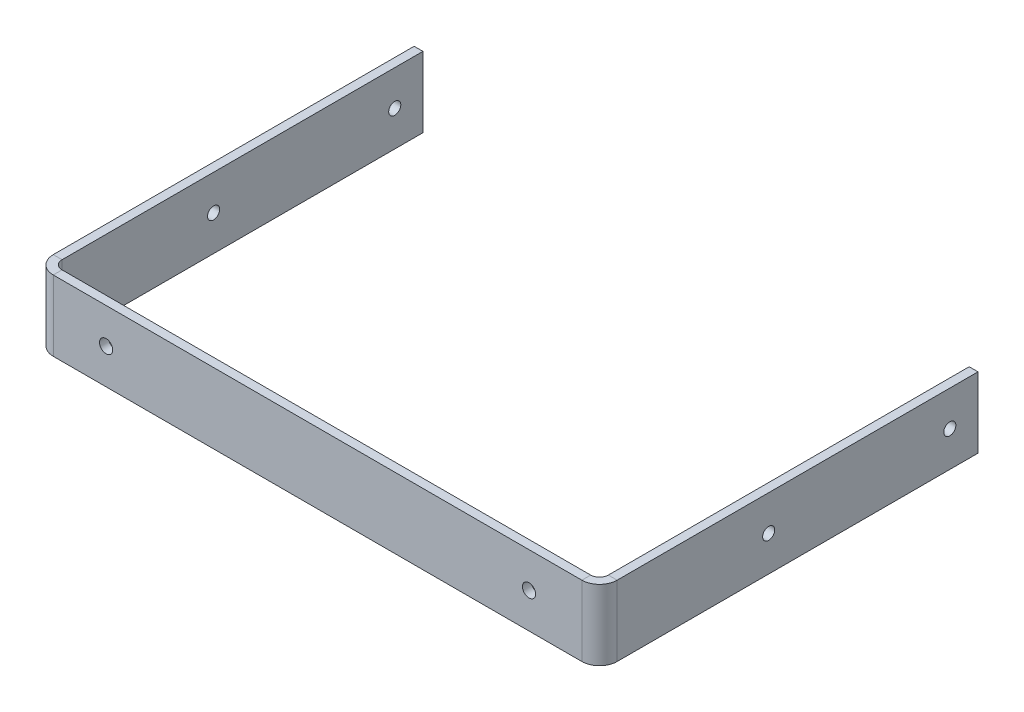
from build123d import *

# Parameters (mm, degrees)
BASE_FLANGE1_DEPTH         = 25.4
F_1_8_0_1250_DOWEL_HOLE1_D = 4.7625
CUT_EXTRUDE1_DEPTH         = 242.668219578
CUT_EXTRUDE1_DEPTH_BACK    = 242.668219578
SKETCH8_R                  = 2.1828125


# Sheet-metal steps are written as plain solids
with BuildPart() as part:
    # Sketch1 → Base-Flange1 (new body)
    with BuildSketch(Plane(origin=(0, 0, 0), x_dir=(1, 0, 0), z_dir=(0, 1, 0))):
        with BuildLine():
            Line((-98.425, 133.223), (-98.425, 3.175))
            ThreePointArc((-98.425, 3.175), (-97.49506403, 0.92993597), (-95.25, 0))
            Line((-95.25, 0), (95.25, 0))
            ThreePointArc((95.25, 0), (97.49506403, 0.92993597), (98.425, 3.175))
            Line((98.425, 3.175), (98.425, 133.223))
            Line((98.425, 133.223), (101.6, 133.223))
            Line((101.6, 133.223), (101.6, 3.175))
            ThreePointArc((101.6, 3.175), (99.740128061, -1.315128061), (95.25, -3.175))
            Line((95.25, -3.175), (-95.25, -3.175))
            ThreePointArc((-95.25, -3.175), (-99.740128061, -1.315128061), (-101.6, 3.175))
            Line((-101.6, 3.175), (-101.6, 133.223))
            Line((-101.6, 133.223), (-98.425, 133.223))
        make_face()
    extrude(amount=BASE_FLANGE1_DEPTH)

    # 1/8 (0.1250) Dowel Hole1 (through all)
    with Locations(Plane(origin=(0, 0, 0), x_dir=(-1, 0, 0), z_dir=(0, 0, -1))):
        with Locations((76.2, 12.7), (-76.2, 12.7)):
            Hole(F_1_8_0_1250_DOWEL_HOLE1_D / 2)

    # Sketch8 → Cut-Extrude1 (cut, two sides: drawn at the far end of the back side and taken through both)
    with BuildSketch(Plane.ZY.offset(-98.425).offset(-CUT_EXTRUDE1_DEPTH_BACK)):
        with Locations((-57.785, 12.7)):
            Circle(SKETCH8_R)
        with Locations((-123.063, 12.7)):
            Circle(SKETCH8_R)
    extrude(amount=CUT_EXTRUDE1_DEPTH + CUT_EXTRUDE1_DEPTH_BACK, mode=Mode.SUBTRACT)


solid = part.part
